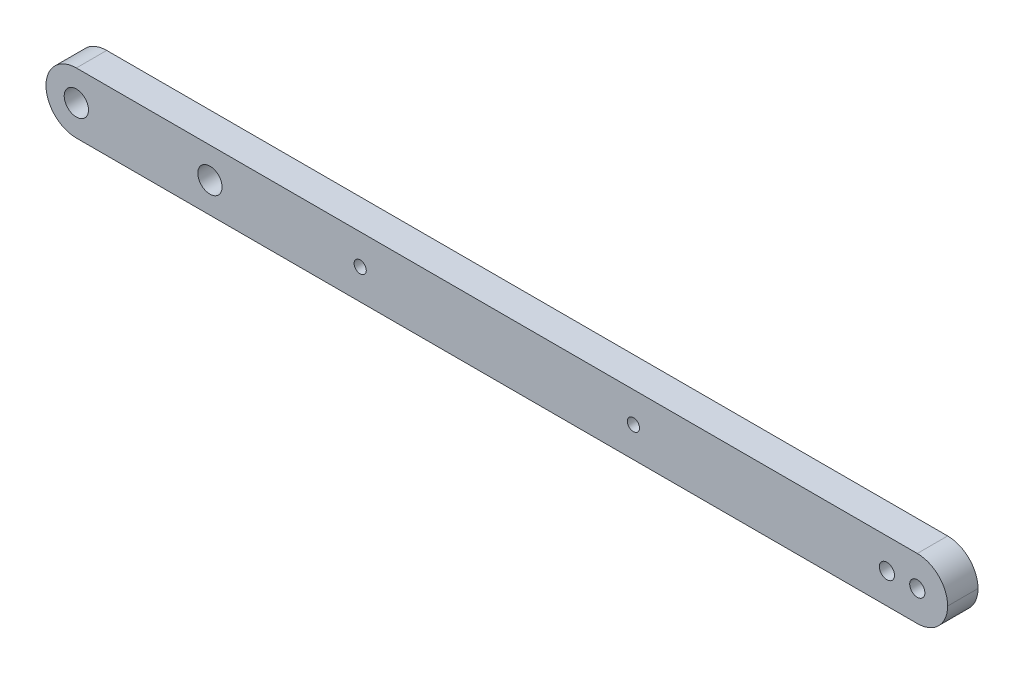
from build123d import *

# Parameters (mm, degrees)
ESQUISSE1_W        = 297
ESQUISSE1_H        = 20
ESQUISSE1_R        = 4
ESQUISSE1_R_2      = 2.5
ESQUISSE1_R_3      = 2
BOSS_EXTRU_1_DEPTH = 10
CONG_1_R           = 10


with BuildPart() as part:
    # Esquisse1 → Boss.-Extru.1 (new body)
    with BuildSketch(Plane.XY):
        with Locations((148.5, 10)):
            Rectangle(ESQUISSE1_W, ESQUISSE1_H)
        with Locations((10, 10)):
            Circle(ESQUISSE1_R, mode=Mode.SUBTRACT)
        with Locations((54, 10)):
            Circle(ESQUISSE1_R, mode=Mode.SUBTRACT)
        with Locations((277, 10)):
            Circle(ESQUISSE1_R_2, mode=Mode.SUBTRACT)
        with Locations((287, 10)):
            Circle(ESQUISSE1_R_2, mode=Mode.SUBTRACT)
        with Locations((103.5, 10)):
            Circle(ESQUISSE1_R_3, mode=Mode.SUBTRACT)
        with Locations((193.5, 10)):
            Circle(ESQUISSE1_R_3, mode=Mode.SUBTRACT)
    extrude(amount=BOSS_EXTRU_1_DEPTH)

    # Congé1
    cong_1_edges = [part.edges().sort_by_distance(p)[0] for p in [
        (0, 0, 5),
        (0, 20, 5),
        (297, 0, 5),
        (297, 20, 5),
    ]]
    fillet(cong_1_edges, radius=CONG_1_R - 0.0001)  # a hair under: the kernel refuses the full size


solid = part.part
